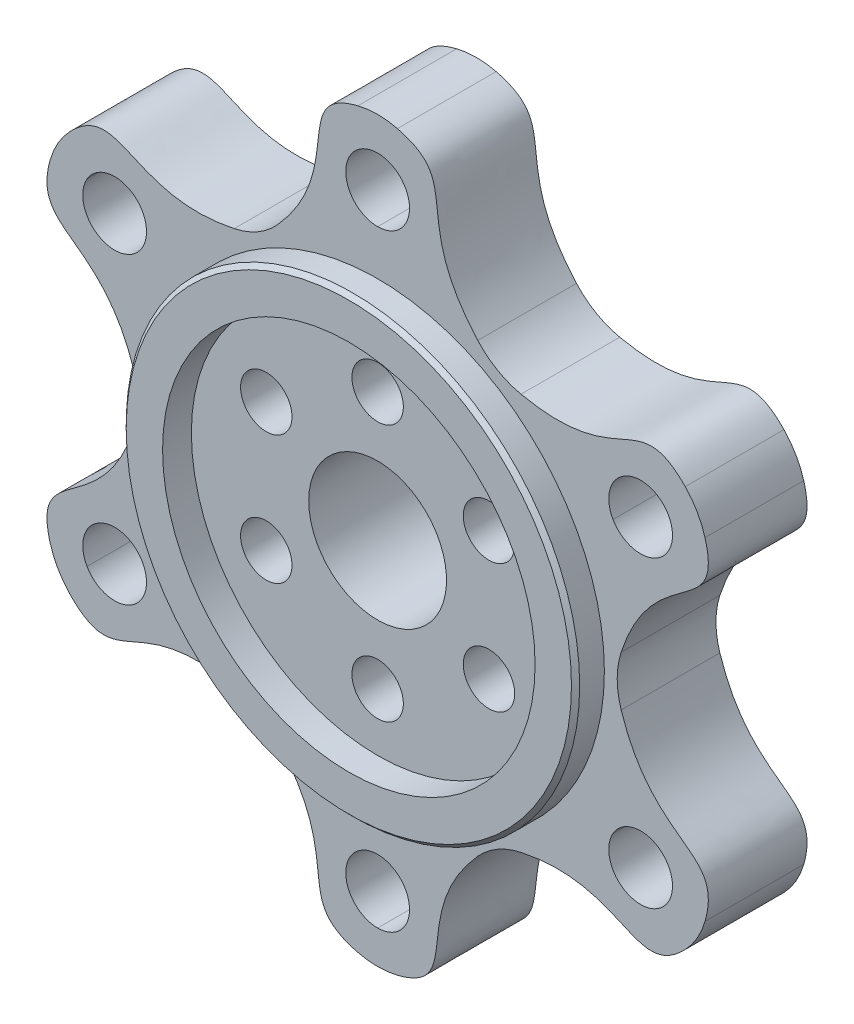
from build123d import *

# Parameters (mm, degrees)
SKETCH1_R           = 45.72
SKETCH1_R_2         = 8.509
SKETCH1_R_3         = 3.175
SKETCH1_R_4         = 3.937
BOSS_EXTRUDE3_DEPTH = 12.192
CUT_EXTRUDE1_START  = -22.86
CUT_EXTRUDE1_DEPTH  = 22.86
SKETCH4_R           = 28
SKETCH4_R_2         = 23
BOSS_EXTRUDE4_DEPTH = 3.556
FILLET1_R           = 10
CHAMFER1_SIZE       = 0.508


with BuildPart() as part:
    # Sketch1 → Boss-Extrude3 (new body)
    with BuildSketch(Plane.XY):
        Circle(SKETCH1_R)
        Circle(SKETCH1_R_2, mode=Mode.SUBTRACT)
        with Locations((0, 15.875)):
            Circle(SKETCH1_R_3, mode=Mode.SUBTRACT)
        with Locations((13.748153285, 7.9375)):
            Circle(SKETCH1_R_3, mode=Mode.SUBTRACT)
        with Locations((13.748153285, -7.9375)):
            Circle(SKETCH1_R_3, mode=Mode.SUBTRACT)
        with Locations((0, -15.875)):
            Circle(SKETCH1_R_3, mode=Mode.SUBTRACT)
        with Locations((-13.748153285, -7.9375)):
            Circle(SKETCH1_R_3, mode=Mode.SUBTRACT)
        with Locations((-13.748153285, 7.9375)):
            Circle(SKETCH1_R_3, mode=Mode.SUBTRACT)
        with Locations((0, 37.5)):
            Circle(SKETCH1_R_4, mode=Mode.SUBTRACT)
        with Locations((32.475952642, 18.75)):
            Circle(SKETCH1_R_4, mode=Mode.SUBTRACT)
        with Locations((32.475952642, -18.75)):
            Circle(SKETCH1_R_4, mode=Mode.SUBTRACT)
        with Locations((0, -37.5)):
            Circle(SKETCH1_R_4, mode=Mode.SUBTRACT)
        with Locations((-32.475952642, -18.75)):
            Circle(SKETCH1_R_4, mode=Mode.SUBTRACT)
        with Locations((-32.475952642, 18.75)):
            Circle(SKETCH1_R_4, mode=Mode.SUBTRACT)
    extrude(amount=BOSS_EXTRUDE3_DEPTH)

    # Sketch2 → Cut-Extrude1 (cut)
    with BuildSketch(Plane.XY.offset(12.192).offset(CUT_EXTRUDE1_START)):
        with BuildLine():
            ThreePointArc((39.594681461, -22.86), (45.72, 0), (39.594681461, 22.86))
            add(Edge.make_bspline(
                [(29.25, 0), (32.932092251, 17.195322725), (44.628878831, 10.61767176), (39.594681461, 22.86)],
                knots=[0, 0, 0, 0, 1, 1, 1, 1], degree=3))
            add(Edge.make_bspline(
                [(29.25, 0), (32.932092251, -17.195322725), (44.628878831, -10.61767176), (39.594681461, -22.86)],
                knots=[0, 0, 0, 0, 1, 1, 1, 1], degree=3))
        make_face()
        with BuildLine():
            add(Edge.make_bspline(
                [(14.625, 25.331243061), (31.357632431, 19.922367126), (31.509612889, 33.34090693), (39.594681461, 22.86)],
                knots=[0, 0, 0, 0, 1, 1, 1, 1], degree=3))
            ThreePointArc((39.594681461, 22.86), (22.86, 39.594681461), (0, 45.72))
            add(Edge.make_bspline(
                [(14.625, 25.331243061), (1.574459819, 37.117689851), (13.119265943, 43.95857869), (0, 45.72)],
                knots=[0, 0, 0, 0, 1, 1, 1, 1], degree=3))
        make_face()
        with BuildLine():
            ThreePointArc((0, -45.72), (22.86, -39.594681461), (39.594681461, -22.86))
            add(Edge.make_bspline(
                [(14.625, -25.331243061), (31.357632431, -19.922367126), (31.509612889, -33.34090693), (39.594681461, -22.86)],
                knots=[0, 0, 0, 0, 1, 1, 1, 1], degree=3))
            add(Edge.make_bspline(
                [(14.625, -25.331243061), (1.574459819, -37.117689851), (13.119265943, -43.95857869), (0, -45.72)],
                knots=[0, 0, 0, 0, 1, 1, 1, 1], degree=3))
        make_face()
        with BuildLine():
            add(Edge.make_bspline(
                [(-14.625, 25.331243061), (-1.574459819, 37.117689851), (-13.119265943, 43.95857869), (0, 45.72)],
                knots=[0, 0, 0, 0, 1, 1, 1, 1], degree=3))
            ThreePointArc((0, 45.72), (-22.86, 39.594681461), (-39.594681461, 22.86))
            add(Edge.make_bspline(
                [(-14.625, 25.331243061), (-31.357632431, 19.922367126), (-31.509612889, 33.34090693), (-39.594681461, 22.86)],
                knots=[0, 0, 0, 0, 1, 1, 1, 1], degree=3))
        make_face()
        with BuildLine():
            ThreePointArc((-39.594681461, -22.86), (-22.86, -39.594681461), (0, -45.72))
            add(Edge.make_bspline(
                [(-14.625, -25.331243061), (-1.574459819, -37.117689851), (-13.119265943, -43.95857869), (0, -45.72)],
                knots=[0, 0, 0, 0, 1, 1, 1, 1], degree=3))
            add(Edge.make_bspline(
                [(-14.625, -25.331243061), (-31.357632431, -19.922367126), (-31.509612889, -33.34090693), (-39.594681461, -22.86)],
                knots=[0, 0, 0, 0, 1, 1, 1, 1], degree=3))
        make_face()
        with BuildLine():
            add(Edge.make_bspline(
                [(-29.25, 0), (-32.932092251, 17.195322725), (-44.628878831, 10.61767176), (-39.594681461, 22.86)],
                knots=[0, 0, 0, 0, 1, 1, 1, 1], degree=3))
            ThreePointArc((-39.594681461, 22.86), (-45.72, 0), (-39.594681461, -22.86))
            add(Edge.make_bspline(
                [(-29.25, 0), (-32.932092251, -17.195322725), (-44.628878831, -10.61767176), (-39.594681461, -22.86)],
                knots=[0, 0, 0, 0, 1, 1, 1, 1], degree=3))
        make_face()
    extrude(amount=CUT_EXTRUDE1_DEPTH, mode=Mode.SUBTRACT)

    # Sketch4 → Boss-Extrude4 (add)
    with BuildSketch(Plane.XY.offset(12.192)):
        Circle(SKETCH4_R)
        Circle(SKETCH4_R_2, mode=Mode.SUBTRACT)
    extrude(amount=BOSS_EXTRUDE4_DEPTH)

    # Fillet1
    fillet1_edges = [part.edges().sort_by_distance(p)[0] for p in [
        (29.25, 0, 6.096),
        (39.594681461, -22.86, 6.096),
        (0, -45.72, 6.096),
        (14.625, -25.331243061, 6.096),
        (-14.625, -25.331243061, 6.096),
        (-39.594681461, -22.86, 6.096),
        (-29.25, 0, 6.096),
        (-39.594681461, 22.86, 6.096),
        (-14.625, 25.331243061, 6.096),
        (14.625, 25.331243061, 6.096),
        (39.594681461, 22.86, 6.096),
        (0, 45.72, 6.096),
    ]]
    fillet(fillet1_edges, radius=FILLET1_R)

    # Chamfer1
    chamfer1_edges = [part.edges().sort_by_distance(p)[0] for p in [
        (-28, 0, 15.748),
    ]]
    chamfer(chamfer1_edges, length=CHAMFER1_SIZE)


solid = part.part
